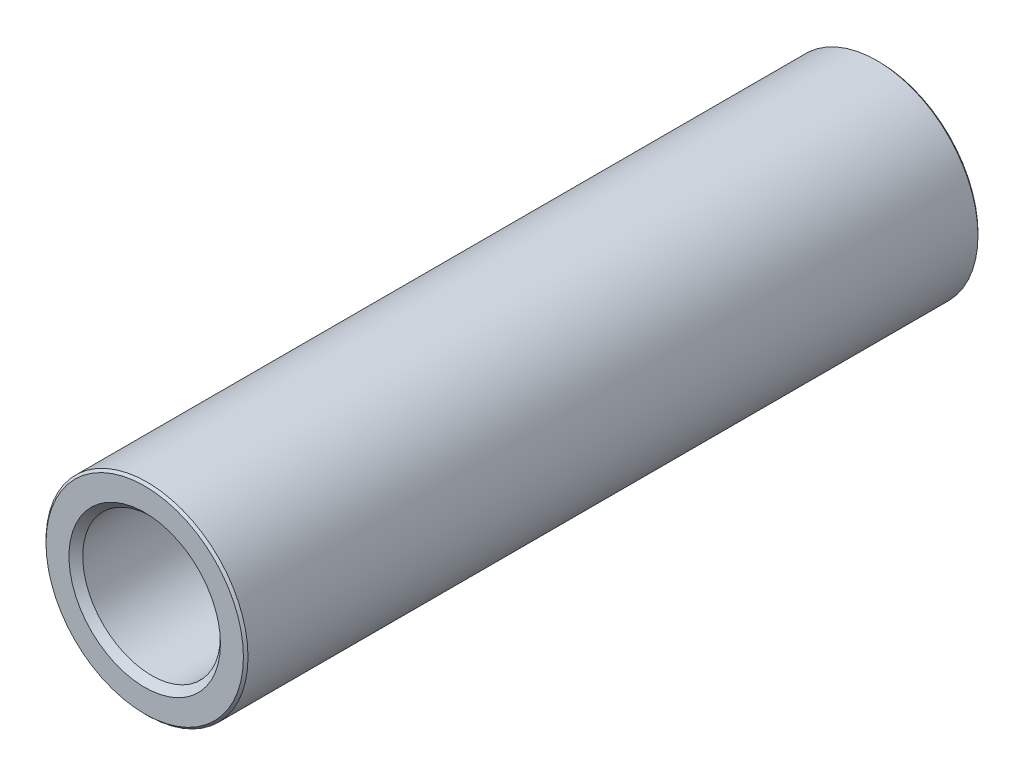
from build123d import *

# Parameters (mm, degrees)
BOSS_EXTRUDE1_DEPTH      = 40
BOSS_EXTRUDE1_DEPTH_BACK = 40
SKETCH1_R                = 11
SKETCH1_R_2              = 7.5
CHAMFER1_SIZE            = 0.25
CHAMFER2_SIZE            = 0.75


with BuildPart() as part:
    # Sketch1 → Boss-Extrude1 (new, two sides: drawn at the far end of the back side and taken through both)
    with BuildSketch(Plane.XY.offset(-BOSS_EXTRUDE1_DEPTH_BACK)):
        Circle(SKETCH1_R)
        Circle(SKETCH1_R_2, mode=Mode.SUBTRACT)
    extrude(amount=BOSS_EXTRUDE1_DEPTH + BOSS_EXTRUDE1_DEPTH_BACK)

    # Chamfer1
    chamfer1_edges = [part.edges().sort_by_distance(p)[0] for p in [
        (-11, 0, -40),
        (-11, 0, 40),
    ]]
    chamfer(chamfer1_edges, length=CHAMFER1_SIZE)

    # Chamfer2
    chamfer2_edges = [part.edges().sort_by_distance(p)[0] for p in [
        (-7.5, 0, 40),
        (-7.5, 0, -40),
    ]]
    chamfer(chamfer2_edges, length=CHAMFER2_SIZE)


solid = part.part
